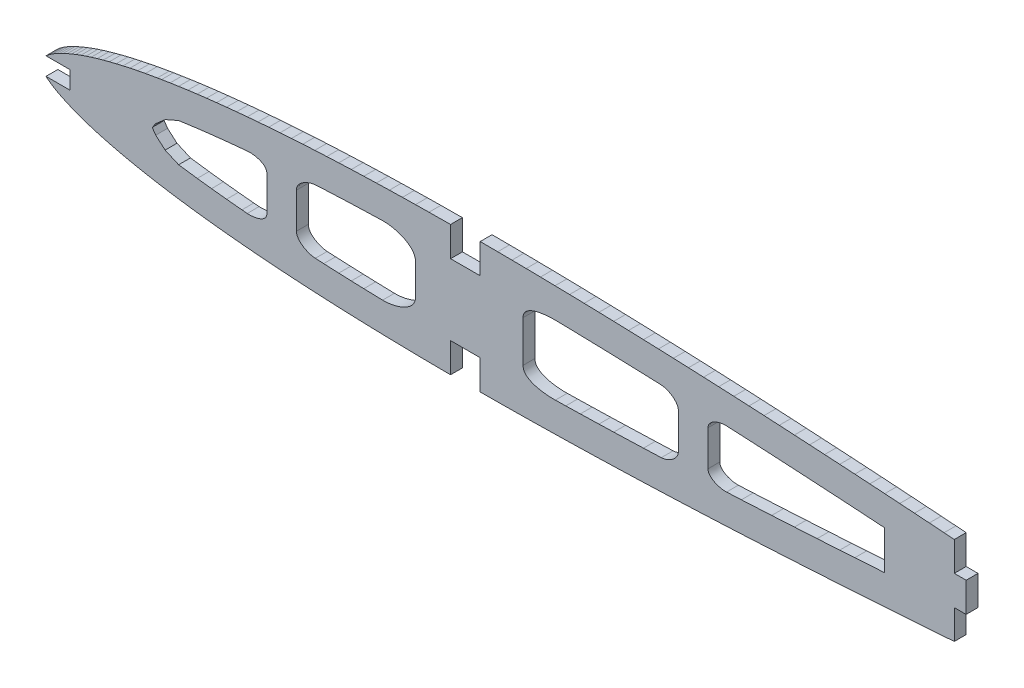
from build123d import *

# Parameters (mm, degrees)
EXTRUDE_2_DEPTH = 2


with BuildPart() as part:
    # Model → 凸台-拉伸2 (new body)
    with BuildSketch(Plane.XY):
        Polygon((365.178384424, -97.376254948), (365.15593908, -97.397254948), (369.216384424, -97.397254948), (369.216384424, -100.397254948), (365.15593908, -100.397254948), (365.178384424, -100.418254948), (365.561384424, -100.734254948), (365.963384424, -101.027254948), (366.379384424, -101.299254948), (366.925384424, -101.620254948), (367.484384424, -101.915254948), (368.052384424, -102.193254948), (368.758384424, -102.517254948), (369.471384424, -102.823254948), (370.191384424, -103.111254948), (371.050384424, -103.431254948), (371.916384424, -103.729254948), (372.789384424, -104.010254948), (373.800384424, -104.313254948), (374.816384424, -104.598254948), (375.836384424, -104.867254948), (376.993384424, -105.154254948), (378.154384424, -105.425254948), (379.318384424, -105.680254948), (380.617384424, -105.947254948), (381.918384424, -106.198254948), (383.223384424, -106.434254948), (384.657384424, -106.679254948), (386.093384424, -106.909254948), (387.532384424, -107.125254948), (389.097384424, -107.346254948), (390.664384424, -107.552254948), (392.233384424, -107.746254948), (393.923384424, -107.940254948), (395.614384424, -108.121254948), (397.306384424, -108.290254948), (399.113384424, -108.458254948), (400.921384424, -108.614254948), (402.730384424, -108.759254948), (404.647384424, -108.900254948), (406.564384424, -109.029254948), (408.482384424, -109.147254948), (410.502384424, -109.260254948), (412.522384424, -109.361254948), (414.543384424, -109.452254948), (416.657384424, -109.537254948), (418.771384424, -109.612254948), (420.886384424, -109.677254948), (423.086384424, -109.735254948), (425.286384424, -109.783254948), (427.486384424, -109.821254948), (429.765384424, -109.851254948), (433.406384424, -109.880254948), (433.412384424, -104.880254948), (438.412384424, -104.886254948), (438.406384424, -109.886254948), (441.360384424, -109.872254948), (443.766384424, -109.852254948), (446.170384424, -109.823254948), (448.576384424, -109.787254948), (451.031384424, -109.742254948), (453.485384424, -109.690254948), (455.940384424, -109.631254948), (458.436384424, -109.564254948), (460.931384424, -109.491254948), (463.426384424, -109.411254948), (465.952384424, -109.323254948), (468.476384424, -109.230254948), (471.001384424, -109.130254948), (473.547384424, -109.024254948), (476.092384424, -108.913254948), (478.638384424, -108.796254948), (481.194384424, -108.672254948), (483.748384424, -108.543254948), (486.303384424, -108.407254948), (488.858384424, -108.266254948), (491.413384424, -108.120254948), (493.968384424, -107.970254948), (496.514384424, -107.819254948), (499.059384424, -107.665254948), (501.605384424, -107.506254948), (504.131384424, -107.343254948), (506.655384424, -107.175254948), (509.180384424, -107.003254948), (511.676384424, -106.831254948), (514.171384424, -106.655254948), (516.666384424, -106.476254948), (518.390324675, -106.34985607), (518.390324675, -101.397254948), (520.390324675, -101.397254948), (520.390324675, -98.897254948), (520.390324675, -96.397254948), (518.390324675, -96.397254948), (518.390324675, -91.44570715), (516.666384424, -91.318254948), (514.171384424, -91.139254948), (511.676384424, -90.963254948), (509.180384424, -90.790254948), (506.655384424, -90.618254948), (504.131384424, -90.450254948), (501.605384424, -90.287254948), (499.059384424, -90.128254948), (496.514384424, -89.974254948), (493.968384424, -89.823254948), (491.413384424, -89.674254948), (488.858384424, -89.528254948), (486.303384424, -89.386254948), (483.748384424, -89.251254948), (481.194384424, -89.121254948), (478.638384424, -88.998254948), (476.092384424, -88.881254948), (473.547384424, -88.769254948), (471.001384424, -88.663254948), (468.476384424, -88.564254948), (465.952384424, -88.470254948), (463.426384424, -88.383254948), (460.931384424, -88.303254948), (458.436384424, -88.230254948), (455.940384424, -88.163254948), (453.485384424, -88.104254948), (451.031384424, -88.052254948), (448.576384424, -88.007254948), (446.170384424, -87.970254948), (443.766384424, -87.942254948), (441.360384424, -87.921254948), (438.406384424, -87.908254948), (438.410384424, -92.908254948), (433.410384424, -92.914254948), (433.406384424, -87.914254948), (429.765384424, -87.942254948), (427.486384424, -87.972254948), (425.286384424, -88.011254948), (423.086384424, -88.059254948), (420.886384424, -88.117254948), (418.771384424, -88.182254948), (416.657384424, -88.256254948), (414.543384424, -88.341254948), (412.522384424, -88.432254948), (410.502384424, -88.534254948), (408.482384424, -88.646254948), (406.564384424, -88.764254948), (404.647384424, -88.894254948), (402.730384424, -89.035254948), (400.921384424, -89.179254948), (399.113384424, -89.335254948), (397.306384424, -89.503254948), (395.614384424, -89.673254948), (393.923384424, -89.854254948), (392.233384424, -90.048254948), (390.664384424, -90.241254948), (389.097384424, -90.448254948), (387.532384424, -90.668254948), (386.093384424, -90.885254948), (384.657384424, -91.115254948), (383.940384424, -91.237254948), (381.918384424, -91.596254948), (380.617384424, -91.847254948), (379.318384424, -92.114254948), (378.154384424, -92.369254948), (376.993384424, -92.640254948), (375.836384424, -92.927254948), (374.816384424, -93.196254948), (373.800384424, -93.480254948), (372.789384424, -93.784254948), (371.916384424, -94.064254948), (371.050384424, -94.363254948), (370.191384424, -94.682254948), (369.471384424, -94.971254948), (368.758384424, -95.277254948), (368.052384424, -95.600254948), (367.484384424, -95.878254948), (366.925384424, -96.174254948), (366.379384424, -96.494254948), (365.963384424, -96.767254948), (365.561384424, -97.060254948), align=None)
        with BuildLine():
            add(Edge.make_bspline(
                [(445.634956017, -95.414080797), (445.634956017, -93.363022625), (449.269417854, -93.019048415), (451.320064617, -93.060127348)],
                knots=[0, 0, 0, 0, 6.153174517, 6.153174517, 6.153174517, 6.153174517], degree=3))
            Line((451.320064617, -93.060127348), (452.836244811, -93.090499748))
            Line((452.836244811, -93.090499748), (455.299671222, -93.147856952))
            Line((455.299671222, -93.147856952), (458.436384424, -93.230254948))
            Line((458.436384424, -93.230254948), (460.931384424, -93.303254948))
            Line((460.931384424, -93.303254948), (465.952384424, -93.470254948))
            Line((465.952384424, -93.470254948), (468.858180977, -93.580378229))
            add(Edge.make_bspline(
                [(468.858180977, -93.580378229), (470.115446563, -93.628025822), (471.837940312, -94.639086816), (471.837940312, -95.897254948)],
                knots=[0, 0, 0, 0, 3.774504395, 3.774504395, 3.774504395, 3.774504395], degree=3))
            Line((471.837940312, -95.897254948), (471.837940312, -101.897254948))
            add(Edge.make_bspline(
                [(468.955890911, -104.210428675), (470.186852362, -104.163777951), (471.837940312, -103.129100061), (471.837940312, -101.897254948)],
                knots=[0, 0, 0, 0, 3.695535339, 3.695535339, 3.695535339, 3.695535339], degree=3))
            Line((468.955890911, -104.210428675), (465.952384424, -104.324254948))
            Line((465.952384424, -104.324254948), (460.931384424, -104.491254948))
            Line((460.931384424, -104.491254948), (458.436384424, -104.564254948))
            Line((458.436384424, -104.564254948), (455.299671222, -104.646652943))
            Line((455.299671222, -104.646652943), (452.836244811, -104.704010147))
            Line((452.836244811, -104.704010147), (451.086109909, -104.739069171))
            add(Edge.make_bspline(
                [(445.634956017, -102.380454948), (445.634956017, -104.360301738), (449.106660244, -104.778721871), (451.086109909, -104.739069171)],
                knots=[0, 0, 0, 0, 5.93954037, 5.93954037, 5.93954037, 5.93954037], degree=3))
            Line((445.634956017, -102.380454948), (445.634956017, -95.414080797))
        make_face(mode=Mode.SUBTRACT)
        with BuildLine():
            Line((385.253151647, -96.670196337), (387.532384424, -95.668254948))
            Line((387.532384424, -95.668254948), (390.664384424, -95.241254948))
            Line((390.664384424, -95.241254948), (393.078384424, -94.951254948))
            Line((393.078384424, -94.951254948), (395.614384424, -94.673254948))
            Line((395.614384424, -94.673254948), (398.209884424, -94.419254948))
            Line((398.209884424, -94.419254948), (399.256008395, -94.326660534))
            add(Edge.make_bspline(
                [(399.256008395, -94.326660534), (400.425031433, -94.223188091), (402.407059943, -94.723661574), (402.407059943, -95.897254948)],
                knots=[0, 0, 0, 0, 3.520780123, 3.520780123, 3.520780123, 3.520780123], degree=3))
            Line((402.407059943, -95.897254948), (402.407059943, -101.897254948))
            add(Edge.make_bspline(
                [(399.107567803, -103.454710604), (400.319033115, -103.561939693), (402.407059943, -103.113456526), (402.407059943, -101.897254948)],
                knots=[0, 0, 0, 0, 3.648604734, 3.648604734, 3.648604734, 3.648604734], degree=3))
            Line((399.107567803, -103.454710604), (398.209884424, -103.375254948))
            Line((398.209884424, -103.375254948), (395.614384424, -103.121254948))
            Line((395.614384424, -103.121254948), (393.078384424, -102.843254948))
            Line((393.078384424, -102.843254948), (390.664384424, -102.553254948))
            Line((390.664384424, -102.553254948), (387.532384424, -102.126254948))
            Line((387.532384424, -102.126254948), (385.253151647, -101.124313558))
            Line((385.253151647, -101.124313558), (383.671211695, -99.742297538))
            Line((383.671211695, -99.742297538), (383.077988193, -98.897254948))
            Line((383.077988193, -98.897254948), (383.671211695, -98.052212358))
            Line((383.671211695, -98.052212358), (385.253151647, -96.670196337))
        make_face(mode=Mode.SUBTRACT)
        with BuildLine():
            add(Edge.make_bspline(
                [(410.750141724, -93.524244431), (409.385459952, -93.595866634), (407.407059943, -94.530695005), (407.407059943, -95.897254948)],
                knots=[0, 0, 0, 0, 4.099679829, 4.099679829, 4.099679829, 4.099679829], degree=3))
            Line((410.750141724, -93.524244431), (412.007899023, -93.458233914))
            Line((412.007899023, -93.458233914), (414.988545957, -93.323355832))
            Line((414.988545957, -93.323355832), (416.657384424, -93.256254948))
            Line((416.657384424, -93.256254948), (418.771384424, -93.182254948))
            Line((418.771384424, -93.182254948), (421.986384424, -93.088254948))
            add(Edge.make_bspline(
                [(421.986384424, -93.088254948), (424.099590721, -93.026469134), (427.486384424, -94.132487735), (427.486384424, -96.246597084)],
                knots=[0, 0, 0, 0, 6.342328047, 6.342328047, 6.342328047, 6.342328047], degree=3))
            Line((427.486384424, -96.246597084), (427.486384424, -101.547954948))
            add(Edge.make_bspline(
                [(421.934277608, -104.704731451), (424.062299307, -104.766950437), (427.486384424, -103.67688603), (427.486384424, -101.547954948)],
                knots=[0, 0, 0, 0, 6.386793248, 6.386793248, 6.386793248, 6.386793248], degree=3))
            Line((421.934277608, -104.704731451), (418.771384424, -104.612254948))
            Line((418.771384424, -104.612254948), (416.657384424, -104.538254948))
            Line((416.657384424, -104.538254948), (414.543384424, -104.453254948))
            Line((414.543384424, -104.453254948), (412.007899023, -104.336275982))
            Line((412.007899023, -104.336275982), (410.590931808, -104.261909696))
            add(Edge.make_bspline(
                [(410.590931808, -104.261909696), (409.270770722, -104.192624059), (407.407059943, -103.219232933), (407.407059943, -101.897254948)],
                knots=[0, 0, 0, 0, 3.965933954, 3.965933954, 3.965933954, 3.965933954], degree=3))
            Line((407.407059943, -101.897254948), (407.407059943, -95.897254948))
        make_face(mode=Mode.SUBTRACT)
        with BuildLine():
            add(Edge.make_bspline(
                [(479.918384424, -94.063004948), (478.724710277, -94.005378493), (476.837940312, -94.702190608), (476.837940312, -95.897254948)],
                knots=[0, 0, 0, 0, 3.58519302, 3.58519302, 3.58519302, 3.58519302], degree=3))
            Line((479.918384424, -94.063004948), (482.471384424, -94.186254948))
            Line((482.471384424, -94.186254948), (487.580884424, -94.457254948))
            Line((487.580884424, -94.457254948), (491.413384424, -94.674254948))
            Line((491.413384424, -94.674254948), (495.241384424, -94.898754948))
            Line((495.241384424, -94.898754948), (499.059384424, -95.128254948))
            Line((499.059384424, -95.128254948), (501.605384424, -95.287254948))
            Line((501.605384424, -95.287254948), (506.655384424, -95.618254948))
            Line((506.655384424, -95.618254948), (506.655384424, -102.176254948))
            Line((506.655384424, -102.176254948), (501.605384424, -102.507254948))
            Line((501.605384424, -102.507254948), (499.059384424, -102.666254948))
            Line((499.059384424, -102.666254948), (495.241384424, -102.895754948))
            Line((495.241384424, -102.895754948), (491.413384424, -103.120254948))
            Line((491.413384424, -103.120254948), (487.580884424, -103.337254948))
            Line((487.580884424, -103.337254948), (482.471384424, -103.608254948))
            Line((482.471384424, -103.608254948), (479.965627503, -103.729224215))
            add(Edge.make_bspline(
                [(479.965627503, -103.729224215), (478.758795619, -103.78748588), (476.837940312, -103.105492349), (476.837940312, -101.897254948)],
                knots=[0, 0, 0, 0, 3.624712204, 3.624712204, 3.624712204, 3.624712204], degree=3))
            Line((476.837940312, -101.897254948), (476.837940312, -95.897254948))
        make_face(mode=Mode.SUBTRACT)
    extrude(amount=EXTRUDE_2_DEPTH)


solid = part.part
